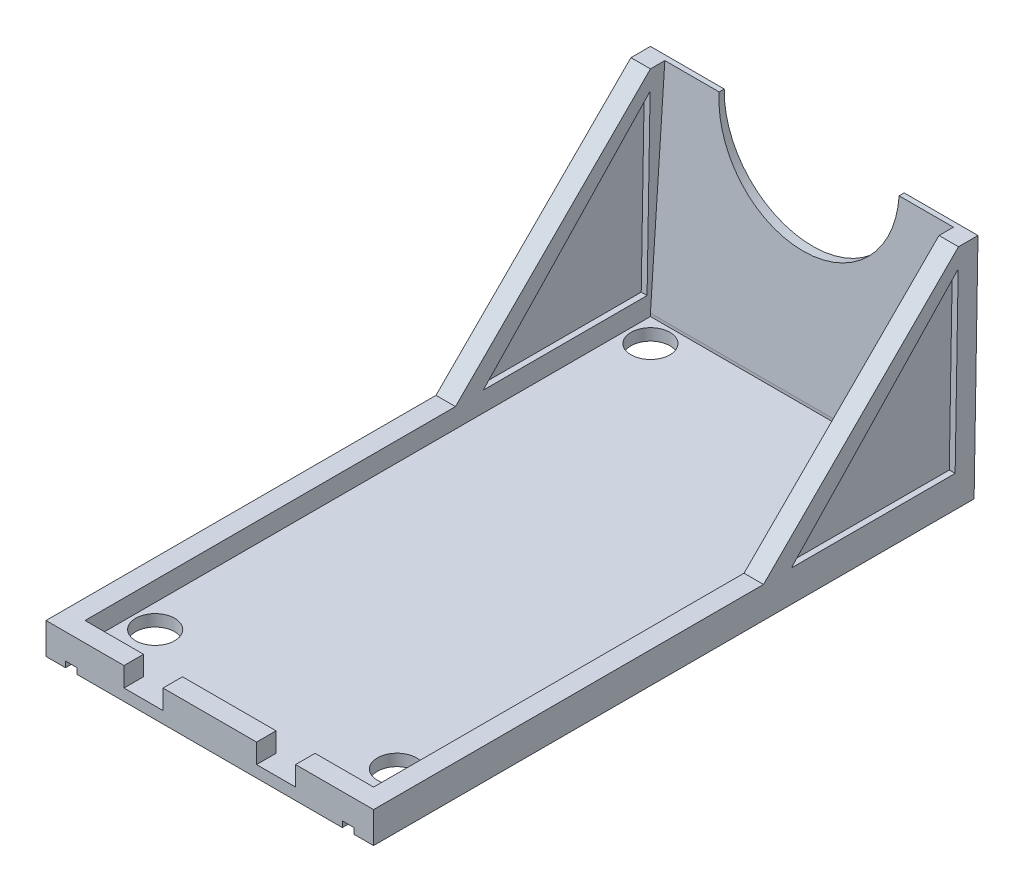
from build123d import *

# Parameters (mm, degrees)
SKETCH1_W            = 84
SKETCH1_H            = 155
BOSS_EXTRUDE1_DEPTH  = 3
SKETCH2_W            = 3
SKETCH2_H            = 3
CUT_EXTRUDE1_DEPTH   = 3
SKETCH3_W            = 5
SKETCH3_H            = 8
BOSS_EXTRUDE2_DEPTH  = 155
SKETCH4_W            = 5
SKETCH4_H            = 8
BOSS_EXTRUDE3_DEPTH  = 155
SKETCH5_W            = 5
SKETCH5_H            = 58
BOSS_EXTRUDE4_DEPTH  = 84
BOSS_EXTRUDE5_DEPTH  = 5
BOSS_EXTRUDE6_DEPTH  = 5
SKETCH8_W            = 84
SKETCH8_H            = 8
BOSS_EXTRUDE8_DEPTH  = 5
SKETCH10_W           = 10
SKETCH10_H           = 7.49718506
CUT_EXTRUDE2_DEPTH   = 5
SKETCH11_W           = 10
SKETCH11_H           = 10.666578164
CUT_EXTRUDE3_DEPTH   = 5
SKETCH12_W           = 2.991300293
SKETCH12_H           = 5
CUT_EXTRUDE4_DEPTH   = 1.5
CUT_EXTRUDE5_DEPTH   = 1.5
SKETCH14_R           = 5
CUT_EXTRUDE6_DEPTH   = 10
SKETCH15_R           = 5
CUT_EXTRUDE7_DEPTH   = 10
SKETCH16_R           = 5
CUT_EXTRUDE8_DEPTH   = 10
CUT_EXTRUDE9_DEPTH   = 90
CUT_EXTRUDE10_DEPTH  = 90
BOSS_EXTRUDE9_DEPTH  = 5
BOSS_EXTRUDE10_DEPTH = 5
CUT_EXTRUDE11_DEPTH  = 1.5
CUT_EXTRUDE12_DEPTH  = 1.5
CUT_EXTRUDE13_DEPTH  = 1.5
CUT_EXTRUDE14_DEPTH  = 1.5
SKETCH26_W           = 49.550858514
SKETCH26_H           = 47.726295706
BOSS_EXTRUDE14_DEPTH = 5
CUT_EXTRUDE16_DEPTH  = 5
BOSS_EXTRUDE15_DEPTH = 5
CUT_EXTRUDE17_DEPTH  = 1.5
BOSS_EXTRUDE16_DEPTH = 1.5
CUT_EXTRUDE18_DEPTH  = 1.5
CUT_EXTRUDE19_DEPTH  = 1.5
CUT_EXTRUDE20_DEPTH  = 1.5
SKETCH35_R           = 23.076743656
CUT_EXTRUDE21_DEPTH  = 10


with BuildPart() as part:
    # Sketch1 → Boss-Extrude1 (new body)
    with BuildSketch(Plane(origin=(0, 0, 0), x_dir=(1, 0, 0), z_dir=(0, 1, 0))):
        Rectangle(SKETCH1_W, SKETCH1_H)
    extrude(amount=BOSS_EXTRUDE1_DEPTH)

    # Sketch2 → Cut-Extrude1 (cut)
    with BuildSketch(Plane(origin=(0, 3, 0), x_dir=(1, 0, 0), z_dir=(0, 1, 0))):
        with Locations((35.5, -71)):
            Rectangle(SKETCH2_W, SKETCH2_H)
        with Locations((-35.5, -71)):
            Rectangle(SKETCH2_W, SKETCH2_H)
    extrude(amount=-CUT_EXTRUDE1_DEPTH, mode=Mode.SUBTRACT)

    # Sketch3 → Boss-Extrude2 (add)
    with BuildSketch(Plane.XY.offset(77.5)):
        with Locations((39.5, 4)):
            Rectangle(SKETCH3_W, SKETCH3_H)
    extrude(amount=-BOSS_EXTRUDE2_DEPTH)

    # Sketch4 → Boss-Extrude3 (add)
    with BuildSketch(Plane.XY.offset(77.5)):
        with Locations((-39.5, 4)):
            Rectangle(SKETCH4_W, SKETCH4_H)
    extrude(amount=-BOSS_EXTRUDE3_DEPTH)

    # Sketch5 → Boss-Extrude4 (add)
    with BuildSketch(Plane.ZY.offset(42)):
        with Locations((-75, 29)):
            Rectangle(SKETCH5_W, SKETCH5_H)
    extrude(amount=-BOSS_EXTRUDE4_DEPTH)

    # Sketch6 → Boss-Extrude5 (add)
    with BuildSketch(Plane.ZY.offset(42)):
        Polygon((-72.5, 58), (-22.5, 8), (-74.300026141, 4.41684906), (-74.300026141, 56.199973859), align=None)
    extrude(amount=-BOSS_EXTRUDE5_DEPTH)

    # Sketch7 → Boss-Extrude6 (add)
    with BuildSketch(Plane(origin=(42, 0, 0), x_dir=(0, 0, -1), z_dir=(1, 0, 0))):
        Polygon((72.5, 58), (19.108860597, 4.608860597), (75.247556584, 4.608860597), (75.247556584, 53.916409465), align=None)
    extrude(amount=-BOSS_EXTRUDE6_DEPTH)

    # Sketch8 → Boss-Extrude8 (add)
    with BuildSketch(Plane.XY.offset(77.5)):
        with Locations((0, 4)):
            Rectangle(SKETCH8_W, SKETCH8_H)
    extrude(amount=-BOSS_EXTRUDE8_DEPTH)

    # Sketch10 → Cut-Extrude2 (cut)
    with BuildSketch(Plane.XY.offset(77.5)):
        with Locations((-17, 6.74859253)):
            Rectangle(SKETCH10_W, SKETCH10_H)
    extrude(amount=-CUT_EXTRUDE2_DEPTH, mode=Mode.SUBTRACT)

    # Sketch11 → Cut-Extrude3 (cut)
    with BuildSketch(Plane.XY.offset(77.5)):
        with Locations((17, 8.333289082)):
            Rectangle(SKETCH11_W, SKETCH11_H)
    extrude(amount=-CUT_EXTRUDE3_DEPTH, mode=Mode.SUBTRACT)

    # Sketch12 → Cut-Extrude4 (cut)
    with BuildSketch(Plane(origin=(0, 0, 0), x_dir=(-1, 0, 0), z_dir=(0, -1, 0))):
        with Locations((35.504349854, -75)):
            Rectangle(SKETCH12_W, SKETCH12_H)
    extrude(amount=-CUT_EXTRUDE4_DEPTH, mode=Mode.SUBTRACT)

    # Sketch13 → Cut-Extrude5 (cut)
    with BuildSketch(Plane(origin=(0, 0, 0), x_dir=(-1, 0, 0), z_dir=(0, -1, 0))):
        Polygon((-34, -72.5), (-34, -80.193887821), (-37, -80.075389367), (-37, -72.5), align=None)
    extrude(amount=-CUT_EXTRUDE5_DEPTH, mode=Mode.SUBTRACT)

    # Sketch14 → Cut-Extrude6 (cut)
    with BuildSketch(Plane(origin=(0, 3, 0), x_dir=(1, 0, 0), z_dir=(0, 1, 0))):
        with Locations((-31, 66.5)):
            Circle(SKETCH14_R)
    extrude(amount=-CUT_EXTRUDE6_DEPTH, mode=Mode.SUBTRACT)

    # Sketch15 → Cut-Extrude7 (cut)
    with BuildSketch(Plane(origin=(0, 3, 0), x_dir=(1, 0, 0), z_dir=(0, 1, 0))):
        with Locations((31, 66.5)):
            Circle(SKETCH15_R)
    extrude(amount=-CUT_EXTRUDE7_DEPTH, mode=Mode.SUBTRACT)

    # Sketch16 → Cut-Extrude8 (cut)
    with BuildSketch(Plane(origin=(0, 3, 0), x_dir=(1, 0, 0), z_dir=(0, 1, 0))):
        with Locations((-31, -60.5)):
            Circle(SKETCH16_R)
        with Locations((31, -60.5)):
            Circle(SKETCH16_R)
    extrude(amount=-CUT_EXTRUDE8_DEPTH, mode=Mode.SUBTRACT)

    # Sketch18 → Cut-Extrude9 (cut)
    with BuildSketch(Plane.ZY.offset(42)):
        Polygon((-72.5, 58), (-76.198635962, 58), (-72.5, 3.743592425), align=None)
    extrude(amount=-CUT_EXTRUDE9_DEPTH, mode=Mode.SUBTRACT)

    # Sketch19 → Cut-Extrude10 (cut)
    with BuildSketch(Plane.ZY.offset(42)):
        Polygon((-77.5, 0), (-76.5, 0), (-77.5, 58), align=None)
    extrude(amount=-CUT_EXTRUDE10_DEPTH, mode=Mode.SUBTRACT)

    # Sketch20 → Boss-Extrude9 (add)
    with BuildSketch(Plane.ZY.offset(42)):
        Polygon((-76.198635962, 58), (-72.5, 58), (-70.787888382, 0), (-74.349317981, 0), align=None)
    extrude(amount=-BOSS_EXTRUDE9_DEPTH)

    # Sketch21 → Boss-Extrude10 (add)
    with BuildSketch(Plane(origin=(42, 0, 0), x_dir=(0, 0, -1), z_dir=(1, 0, 0))):
        Polygon((76.198635962, 58), (72.5, 58), (70.737076785, 0), (74.878898856, 0), align=None)
    extrude(amount=-BOSS_EXTRUDE10_DEPTH)

    # Sketch22 → Cut-Extrude11 (cut)
    with BuildSketch(Plane(origin=(42, 0, 0), x_dir=(0, 0, -1), z_dir=(1, 0, 0))):
        Polygon((72.177267661, 51.285216768), (29.763379307, 8.871328414), (72.177267661, 8.871328414), align=None)
    extrude(amount=-CUT_EXTRUDE11_DEPTH, mode=Mode.SUBTRACT)

    # Sketch23 → Cut-Extrude12 (cut)
    with BuildSketch(Plane.ZY.offset(-37)):
        Polygon((-71.672501521, 51.518221256), (-71.672501521, 9.262373833), (-29.274855334, 9.262373833), align=None)
    extrude(amount=-CUT_EXTRUDE12_DEPTH, mode=Mode.SUBTRACT)

    # Sketch24 → Cut-Extrude13 (cut)
    with BuildSketch(Plane.ZY.offset(42)):
        Polygon((-71.672501521, 51.518221256), (-71.672501521, 9.262373833), (-29.274855334, 9.262373833), align=None)
    extrude(amount=-CUT_EXTRUDE13_DEPTH, mode=Mode.SUBTRACT)

    # Sketch25 → Cut-Extrude14 (cut)
    with BuildSketch(Plane(origin=(-37, 0, 0), x_dir=(0, 0, -1), z_dir=(1, 0, 0))):
        Polygon((72.177267661, 51.285216768), (29.763379307, 8.871328414), (71.672501521, 9.262373833), align=None)
    extrude(amount=-CUT_EXTRUDE14_DEPTH, mode=Mode.SUBTRACT)

    # Sketch26 → Boss-Extrude14 (add)
    with BuildSketch(Plane.ZY.offset(42)):
        with Locations((-48.154791667, 31.077548196)):
            Rectangle(SKETCH26_W, SKETCH26_H)
    extrude(amount=-BOSS_EXTRUDE14_DEPTH)

    # Sketch28 → Cut-Extrude16 (cut)
    with BuildSketch(Plane.ZY.offset(42)):
        Polygon((-72.5, 58), (-22.5, 8), (-3.819978288, 78.814442414), (-53.567190148, 70.302981165), align=None)
    extrude(amount=-CUT_EXTRUDE16_DEPTH, mode=Mode.SUBTRACT)

    # Sketch29 → Boss-Extrude15 (add)
    with BuildSketch(Plane(origin=(42, 0, 0), x_dir=(0, 0, -1), z_dir=(1, 0, 0))):
        Polygon((29.763379307, 8.871328414), (72.177267661, 51.285216768), (75.229909626, 8.871328414), (31.711163149, 2.829562271), align=None)
    extrude(amount=-BOSS_EXTRUDE15_DEPTH)

    # Sketch30 → Cut-Extrude17 (cut)
    with BuildSketch(Plane(origin=(42, 0, 0), x_dir=(0, 0, -1), z_dir=(1, 0, 0))):
        Polygon((72.414548911, 53.086937084), (71.638802135, 8.093624059), (29.638802135, 8.093624059), align=None)
    extrude(amount=-CUT_EXTRUDE17_DEPTH, mode=Mode.SUBTRACT)

    # Sketch31 → Boss-Extrude16 (add)
    with BuildSketch(Plane.ZY.offset(-37)):
        Polygon((-72.102184133, 54.628890021), (-24.3271117, 8.270834631), (-37.754587501, 5.882396002), (-74.878055335, 49.673216561), align=None)
    extrude(amount=-BOSS_EXTRUDE16_DEPTH)

    # Sketch32 → Cut-Extrude18 (cut)
    with BuildSketch(Plane.ZY.offset(-37)):
        Polygon((-72.414548911, 53.086937084), (-71.638802135, 8.093624059), (-29.638802135, 8.093624059), align=None)
    extrude(amount=-CUT_EXTRUDE18_DEPTH, mode=Mode.SUBTRACT)

    # Sketch33 → Cut-Extrude19 (cut)
    with BuildSketch(Plane.ZY.offset(42)):
        Polygon((-29.638802135, 8.093624059), (-72.414548911, 53.086937084), (-71.638802135, 8.093624059), align=None)
    extrude(amount=-CUT_EXTRUDE19_DEPTH, mode=Mode.SUBTRACT)

    # Sketch34 → Cut-Extrude20 (cut)
    with BuildSketch(Plane(origin=(-37, 0, 0), x_dir=(0, 0, -1), z_dir=(1, 0, 0))):
        Polygon((72.414548911, 53.086937084), (71.638802135, 8.093624059), (29.638802135, 8.093624059), align=None)
    extrude(amount=-CUT_EXTRUDE20_DEPTH, mode=Mode.SUBTRACT)

    # Sketch35 → Cut-Extrude21 (cut)
    with BuildSketch(Plane(origin=(0, -4.902116419, -71.910625748), x_dir=(1, 0, 0), z_dir=(0, 0.06801172463172912, 0.9976845219369789))):
        with Locations((0, 63.048102919)):
            Circle(SKETCH35_R)
    extrude(amount=-CUT_EXTRUDE21_DEPTH, mode=Mode.SUBTRACT)


solid = part.part
